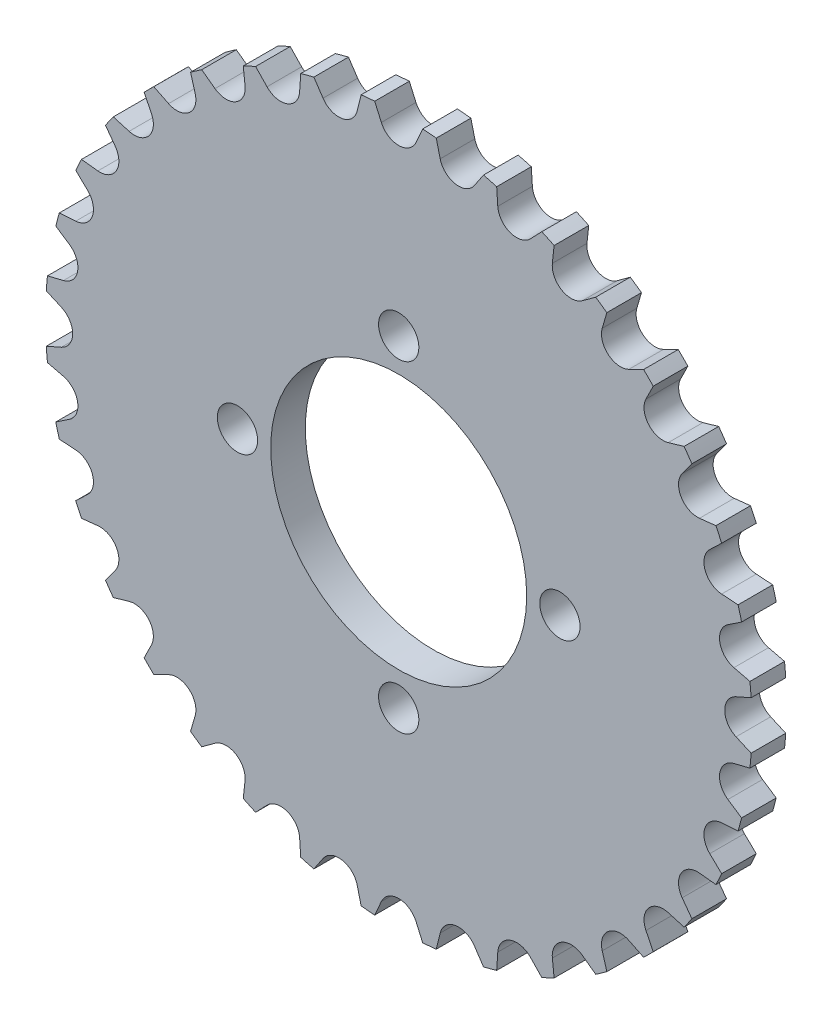
from build123d import *

# Parameters (mm, degrees)
BOSS_EXTRUDE1_DEPTH = 7.3
SKETCH9_R           = 100
SKETCH9_R_2         = 74.5
CUT_EXTRUDE5_DEPTH  = 10
SKETCH10_R          = 27
SKETCH10_R_2        = 4.25
CUT_EXTRUDE6_DEPTH  = 106.368640397


with BuildPart() as part:
    # Sketch1 → Boss-Extrude1 (new body)
    with BuildSketch(Plane.XY):
        with BuildLine():
            ThreePointArc((3.659616426, 71.150315011), (0, 68.765), (-3.659616426, 71.150315011))
            Line((-3.659616426, 71.150315011), (-5.674070045, 75.715990423))
            ThreePointArc((-5.674070045, 75.715990423), (-6.676129894, 76.308513874), (-7.560075586, 75.550986319))
            Line((-7.560075586, 75.550986319), (-8.751103913, 70.704867575))
            ThreePointArc((-8.751103913, 70.704867575), (-11.940916937, 67.720305136), (-15.959141171, 69.433896128))
            Line((-15.959141171, 69.433896128), (-18.735811929, 73.580402472))
            ThreePointArc((-18.735811929, 73.580402472), (-19.825538855, 73.989918294), (-20.564512145, 73.090403726))
            Line((-20.564512145, 73.090403726), (-20.895926387, 68.111088517))
            ThreePointArc((-20.895926387, 68.111088517), (-23.519015156, 64.617963068), (-27.773755488, 65.607763448))
            Line((-27.773755488, 65.607763448), (-31.228275648, 69.209111226))
            ThreePointArc((-31.228275648, 69.209111226), (-32.372558849, 69.423176487), (-32.94410641, 68.409006202))
            Line((-32.94410641, 68.409006202), (-32.405836712, 63.4477885))
            ThreePointArc((-32.405836712, 63.4477885), (-34.3825, 59.552236891), (-38.744478298, 59.788172074))
            Line((-38.744478298, 59.788172074), (-42.771884014, 62.734936156))
            ThreePointArc((-42.771884014, 62.734936156), (-43.935955024, 62.747046593), (-44.322710671, 61.64903564))
            Line((-44.322710671, 61.64903564), (-42.931112087, 56.856659535))
            ThreePointArc((-42.931112087, 56.856659535), (-44.20128998, 52.677046131), (-48.537969741, 52.151947345))
            Line((-48.537969741, 52.151947345), (-53.015890327, 54.354591797))
            ThreePointArc((-53.015890327, 54.354591797), (-54.164379439, 54.164379439), (-54.354591797, 53.015890327))
            Line((-54.354591797, 53.015890327), (-52.151947345, 48.537969741))
            ThreePointArc((-52.151947345, 48.537969741), (-52.677046131, 44.20128998), (-56.856659535, 42.931112087))
            Line((-56.856659535, 42.931112087), (-61.64903564, 44.322710671))
            ThreePointArc((-61.64903564, 44.322710671), (-62.747046593, 43.935955024), (-62.734936156, 42.771884014))
            Line((-62.734936156, 42.771884014), (-59.788172074, 38.744478298))
            ThreePointArc((-59.788172074, 38.744478298), (-59.552236891, 34.3825), (-63.4477885, 32.405836712))
            Line((-63.4477885, 32.405836712), (-68.409006202, 32.94410641))
            ThreePointArc((-68.409006202, 32.94410641), (-69.423176487, 32.372558849), (-69.209111226, 31.228275648))
            Line((-69.209111226, 31.228275648), (-65.607763448, 27.773755488))
            ThreePointArc((-65.607763448, 27.773755488), (-64.617963068, 23.519015156), (-68.111088517, 20.895926387))
            Line((-68.111088517, 20.895926387), (-73.090403726, 20.564512145))
            ThreePointArc((-73.090403726, 20.564512145), (-73.989918294, 19.825538855), (-73.580402472, 18.735811929))
            Line((-73.580402472, 18.735811929), (-69.433896128, 15.959141171))
            ThreePointArc((-69.433896128, 15.959141171), (-67.720305136, 11.940916937), (-70.704867575, 8.751103913))
            Line((-70.704867575, 8.751103913), (-75.550986319, 7.560075586))
            ThreePointArc((-75.550986319, 7.560075586), (-76.308513874, 6.676129894), (-75.715990423, 5.674070045))
            Line((-75.715990423, 5.674070045), (-71.150315011, 3.659616426))
            ThreePointArc((-71.150315011, 3.659616426), (-68.765, 0), (-71.150315011, -3.659616426))
            Line((-71.150315011, -3.659616426), (-75.715990423, -5.674070045))
            ThreePointArc((-75.715990423, -5.674070045), (-76.308513874, -6.676129894), (-75.550986319, -7.560075586))
            Line((-75.550986319, -7.560075586), (-70.704867575, -8.751103913))
            ThreePointArc((-70.704867575, -8.751103913), (-67.720305136, -11.940916937), (-69.433896128, -15.959141171))
            Line((-69.433896128, -15.959141171), (-73.580402472, -18.735811929))
            ThreePointArc((-73.580402472, -18.735811929), (-73.989918294, -19.825538855), (-73.090403726, -20.564512145))
            Line((-73.090403726, -20.564512145), (-68.111088517, -20.895926387))
            ThreePointArc((-68.111088517, -20.895926387), (-64.617963068, -23.519015156), (-65.607763448, -27.773755488))
            Line((-65.607763448, -27.773755488), (-69.209111226, -31.228275648))
            ThreePointArc((-69.209111226, -31.228275648), (-69.423176487, -32.372558849), (-68.409006202, -32.94410641))
            Line((-68.409006202, -32.94410641), (-63.4477885, -32.405836712))
            ThreePointArc((-63.4477885, -32.405836712), (-59.552236891, -34.3825), (-59.788172074, -38.744478298))
            Line((-59.788172074, -38.744478298), (-62.734936156, -42.771884014))
            ThreePointArc((-62.734936156, -42.771884014), (-62.747046593, -43.935955024), (-61.64903564, -44.322710671))
            Line((-61.64903564, -44.322710671), (-56.856659535, -42.931112087))
            ThreePointArc((-56.856659535, -42.931112087), (-52.677046131, -44.20128998), (-52.151947345, -48.537969741))
            Line((-52.151947345, -48.537969741), (-54.354591797, -53.015890327))
            ThreePointArc((-54.354591797, -53.015890327), (-54.164379439, -54.164379439), (-53.015890327, -54.354591797))
            Line((-53.015890327, -54.354591797), (-48.537969741, -52.151947345))
            ThreePointArc((-48.537969741, -52.151947345), (-44.20128998, -52.677046131), (-42.931112087, -56.856659535))
            Line((-42.931112087, -56.856659535), (-44.322710671, -61.64903564))
            ThreePointArc((-44.322710671, -61.64903564), (-43.935955024, -62.747046593), (-42.771884014, -62.734936156))
            Line((-42.771884014, -62.734936156), (-38.744478298, -59.788172074))
            ThreePointArc((-38.744478298, -59.788172074), (-34.3825, -59.552236891), (-32.405836712, -63.4477885))
            Line((-32.405836712, -63.4477885), (-32.94410641, -68.409006202))
            ThreePointArc((-32.94410641, -68.409006202), (-32.372558849, -69.423176487), (-31.228275648, -69.209111226))
            Line((-31.228275648, -69.209111226), (-27.773755488, -65.607763448))
            ThreePointArc((-27.773755488, -65.607763448), (-23.519015156, -64.617963068), (-20.895926387, -68.111088517))
            Line((-20.895926387, -68.111088517), (-20.564512145, -73.090403726))
            ThreePointArc((-20.564512145, -73.090403726), (-19.825538855, -73.989918294), (-18.735811929, -73.580402472))
            Line((-18.735811929, -73.580402472), (-15.959141171, -69.433896128))
            ThreePointArc((-15.959141171, -69.433896128), (-11.940916937, -67.720305136), (-8.751103913, -70.704867575))
            Line((-8.751103913, -70.704867575), (-7.560075586, -75.550986319))
            ThreePointArc((-7.560075586, -75.550986319), (-6.676129894, -76.308513874), (-5.674070045, -75.715990423))
            Line((-5.674070045, -75.715990423), (-3.659616426, -71.150315011))
            ThreePointArc((-3.659616426, -71.150315011), (0, -68.765), (3.659616426, -71.150315011))
            Line((3.659616426, -71.150315011), (5.674070045, -75.715990423))
            ThreePointArc((5.674070045, -75.715990423), (6.676129894, -76.308513874), (7.560075586, -75.550986319))
            Line((7.560075586, -75.550986319), (8.751103913, -70.704867575))
            ThreePointArc((8.751103913, -70.704867575), (11.940916937, -67.720305136), (15.959141171, -69.433896128))
            Line((15.959141171, -69.433896128), (18.735811929, -73.580402472))
            ThreePointArc((18.735811929, -73.580402472), (19.825538855, -73.989918294), (20.564512145, -73.090403726))
            Line((20.564512145, -73.090403726), (20.895926387, -68.111088517))
            ThreePointArc((20.895926387, -68.111088517), (23.519015156, -64.617963068), (27.773755488, -65.607763448))
            Line((27.773755488, -65.607763448), (31.228275648, -69.209111226))
            ThreePointArc((31.228275648, -69.209111226), (32.372558849, -69.423176487), (32.94410641, -68.409006202))
            Line((32.94410641, -68.409006202), (32.405836712, -63.4477885))
            ThreePointArc((32.405836712, -63.4477885), (34.3825, -59.552236891), (38.744478298, -59.788172074))
            Line((38.744478298, -59.788172074), (42.771884014, -62.734936156))
            ThreePointArc((42.771884014, -62.734936156), (43.935955024, -62.747046593), (44.322710671, -61.64903564))
            Line((44.322710671, -61.64903564), (42.931112087, -56.856659535))
            ThreePointArc((42.931112087, -56.856659535), (44.20128998, -52.677046131), (48.537969741, -52.151947345))
            Line((48.537969741, -52.151947345), (53.015890327, -54.354591797))
            ThreePointArc((53.015890327, -54.354591797), (54.164379439, -54.164379439), (54.354591797, -53.015890327))
            Line((54.354591797, -53.015890327), (52.151947345, -48.537969741))
            ThreePointArc((52.151947345, -48.537969741), (52.677046131, -44.20128998), (56.856659535, -42.931112087))
            Line((56.856659535, -42.931112087), (61.64903564, -44.322710671))
            ThreePointArc((61.64903564, -44.322710671), (62.747046593, -43.935955024), (62.734936156, -42.771884014))
            Line((62.734936156, -42.771884014), (59.788172074, -38.744478298))
            ThreePointArc((59.788172074, -38.744478298), (59.552236891, -34.3825), (63.4477885, -32.405836712))
            Line((63.4477885, -32.405836712), (68.409006202, -32.94410641))
            ThreePointArc((68.409006202, -32.94410641), (69.423176487, -32.372558849), (69.209111226, -31.228275648))
            Line((69.209111226, -31.228275648), (65.607763448, -27.773755488))
            ThreePointArc((65.607763448, -27.773755488), (64.617963068, -23.519015156), (68.111088517, -20.895926387))
            Line((68.111088517, -20.895926387), (73.090403726, -20.564512145))
            ThreePointArc((73.090403726, -20.564512145), (73.989918294, -19.825538855), (73.580402472, -18.735811929))
            Line((73.580402472, -18.735811929), (69.433896128, -15.959141171))
            ThreePointArc((69.433896128, -15.959141171), (67.720305136, -11.940916937), (70.704867575, -8.751103913))
            Line((70.704867575, -8.751103913), (75.550986319, -7.560075586))
            ThreePointArc((75.550986319, -7.560075586), (76.308513874, -6.676129894), (75.715990423, -5.674070045))
            Line((75.715990423, -5.674070045), (71.150315011, -3.659616426))
            ThreePointArc((71.150315011, -3.659616426), (68.765, 0), (71.150315011, 3.659616426))
            Line((71.150315011, 3.659616426), (75.715990423, 5.674070045))
            ThreePointArc((75.715990423, 5.674070045), (76.308513874, 6.676129894), (75.550986319, 7.560075586))
            Line((75.550986319, 7.560075586), (70.704867575, 8.751103913))
            ThreePointArc((70.704867575, 8.751103913), (67.720305136, 11.940916937), (69.433896128, 15.959141171))
            Line((69.433896128, 15.959141171), (73.580402472, 18.735811929))
            ThreePointArc((73.580402472, 18.735811929), (73.989918294, 19.825538855), (73.090403726, 20.564512145))
            Line((73.090403726, 20.564512145), (68.111088517, 20.895926387))
            ThreePointArc((68.111088517, 20.895926387), (64.617963068, 23.519015156), (65.607763448, 27.773755488))
            Line((65.607763448, 27.773755488), (69.209111226, 31.228275648))
            ThreePointArc((69.209111226, 31.228275648), (69.423176487, 32.372558849), (68.409006202, 32.94410641))
            Line((68.409006202, 32.94410641), (63.4477885, 32.405836712))
            ThreePointArc((63.4477885, 32.405836712), (59.552236891, 34.3825), (59.788172074, 38.744478298))
            Line((59.788172074, 38.744478298), (62.734936156, 42.771884014))
            ThreePointArc((62.734936156, 42.771884014), (62.747046593, 43.935955024), (61.64903564, 44.322710671))
            Line((61.64903564, 44.322710671), (56.856659535, 42.931112087))
            ThreePointArc((56.856659535, 42.931112087), (52.677046131, 44.20128998), (52.151947345, 48.537969741))
            Line((52.151947345, 48.537969741), (54.354591797, 53.015890327))
            ThreePointArc((54.354591797, 53.015890327), (54.164379439, 54.164379439), (53.015890327, 54.354591797))
            Line((53.015890327, 54.354591797), (48.537969741, 52.151947345))
            ThreePointArc((48.537969741, 52.151947345), (44.20128998, 52.677046131), (42.931112087, 56.856659535))
            Line((42.931112087, 56.856659535), (44.322710671, 61.64903564))
            ThreePointArc((44.322710671, 61.64903564), (43.935955024, 62.747046593), (42.771884014, 62.734936156))
            Line((42.771884014, 62.734936156), (38.744478298, 59.788172074))
            ThreePointArc((38.744478298, 59.788172074), (34.3825, 59.552236891), (32.405836712, 63.4477885))
            Line((32.405836712, 63.4477885), (32.94410641, 68.409006202))
            ThreePointArc((32.94410641, 68.409006202), (32.372558849, 69.423176487), (31.228275648, 69.209111226))
            Line((31.228275648, 69.209111226), (27.773755488, 65.607763448))
            ThreePointArc((27.773755488, 65.607763448), (23.519015156, 64.617963068), (20.895926387, 68.111088517))
            Line((20.895926387, 68.111088517), (20.564512145, 73.090403726))
            ThreePointArc((20.564512145, 73.090403726), (19.825538855, 73.989918294), (18.735811929, 73.580402472))
            Line((18.735811929, 73.580402472), (15.959141171, 69.433896128))
            ThreePointArc((15.959141171, 69.433896128), (11.940916937, 67.720305136), (8.751103913, 70.704867575))
            Line((8.751103913, 70.704867575), (7.560075586, 75.550986319))
            ThreePointArc((7.560075586, 75.550986319), (6.676129894, 76.308513874), (5.674070045, 75.715990423))
            Line((5.674070045, 75.715990423), (3.659616426, 71.150315011))
        make_face()
    extrude(amount=BOSS_EXTRUDE1_DEPTH)

    # Sketch9 → Cut-Extrude5 (cut)
    with BuildSketch(Plane(origin=(0, 0, 0), x_dir=(-1, 0, 0), z_dir=(0, 0, -1))):
        Circle(SKETCH9_R)
        Circle(SKETCH9_R_2, mode=Mode.SUBTRACT)
    extrude(amount=-CUT_EXTRUDE5_DEPTH, mode=Mode.SUBTRACT)

    # Sketch10 → Cut-Extrude6 (cut, through all)
    with BuildSketch(Plane.XY.offset(7.3)):
        Circle(SKETCH10_R)
        with Locations((0, 34)):
            Circle(SKETCH10_R_2)
        with Locations((34, 0)):
            Circle(SKETCH10_R_2)
        with Locations((0, -34)):
            Circle(SKETCH10_R_2)
        with Locations((-34, 0)):
            Circle(SKETCH10_R_2)
    extrude(amount=-CUT_EXTRUDE6_DEPTH, mode=Mode.SUBTRACT)


solid = part.part
